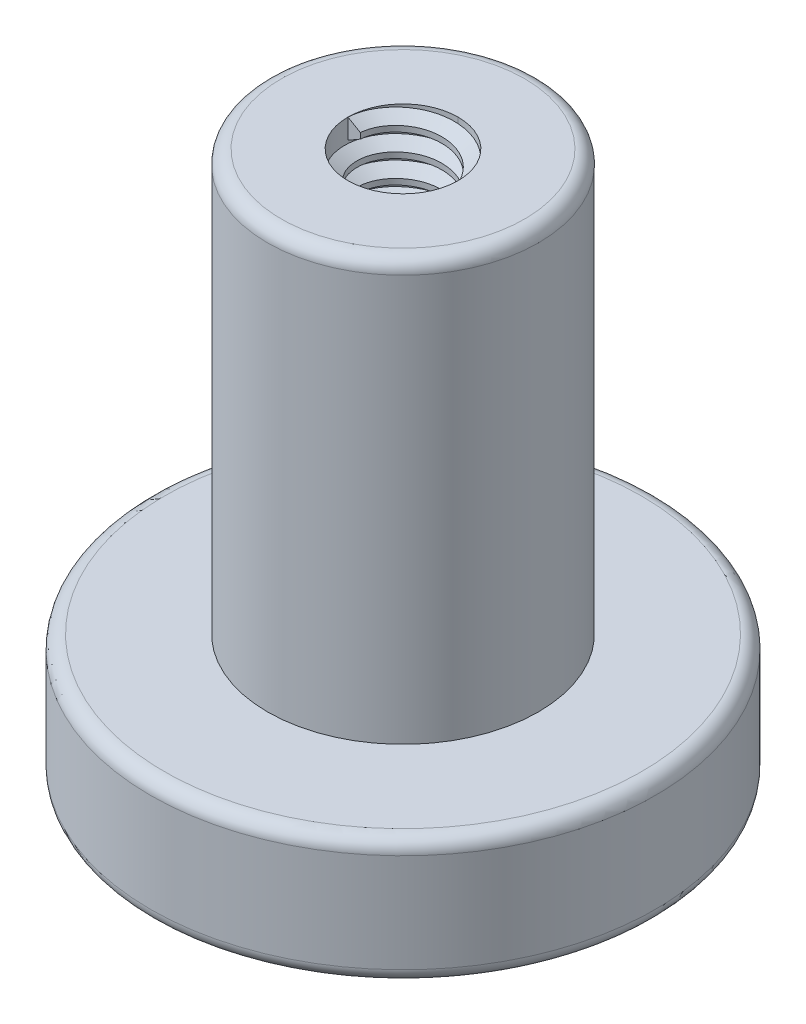
from build123d import *

# Parameters (mm, degrees)
FILLET1_R     = 0.3
CHAMFER1_SIZE = 1
FILLET2_R     = 0.1
THREAD1_PITCH = 0.5


with BuildPart() as part:
    # Sketch1 → Revolve1 (revolve)
    with BuildSketch(Plane(origin=(0, 0, 0), x_dir=(0, 0, -1), z_dir=(1, 0, 0)), mode=Mode.PRIVATE) as revolve1_sk:
        Polygon((-2.95, 11.3), (-2.95, 2.15), (-5.5, 2.15), (-5.5, -0.6), (-4.3, -0.6), (-4.3, 0), (-2.5, 0), (-2.5, 1.2), (-2.1, 1.2), (-2.1, 7.5), (-1.2, 7.5), (-1.2, 11.3), align=None)
    revolve(revolve1_sk.sketch.rotate(Axis((0, 0, 0), (0, 1, 0)), 180), axis=Axis((0, 0, 0), (0, 1, 0)))

    # Fillet1
    fillet1_edges = [part.edges().sort_by_distance(p)[0] for p in [
        (0, 11.3, 2.95),
        (0, 2.15, 5.5),
        (0, -0.6, 5.5),
    ]]
    fillet(fillet1_edges, radius=FILLET1_R)

    # Chamfer1
    # the kernel refuses this chamfer: 1 mm, written as the material it takes off along each edge
    with BuildSketch(Plane(origin=(0, 1.2, 0), x_dir=(0, 0, -1), z_dir=(1, 0, 0))) as chamfer1_piece_1_section:
        Polygon((2.1, CHAMFER1_SIZE), (2.1 + CHAMFER1_SIZE, 0), (2.1, 0), align=None)
    chamfer1_piece_1 = revolve(axis=Axis((0, 1.2, 0), (0, 1, 0)), mode=Mode.PRIVATE)
    chamfer1_piece_1 = chamfer1_piece_1 & Plane(origin=(0, 2.002033499, 0), x_dir=(0, 0, -1), z_dir=(0, 1, 0)) * Cylinder(2.5, 13, mode=Mode.PRIVATE)
    add(chamfer1_piece_1, mode=Mode.SUBTRACT)

    # Fillet2
    fillet2_edges = [part.edges().sort_by_distance(p)[0] for p in [
        (0, -0.6, 4.3),
        (0, 0, 4.3),
        (0, 0, 2.5),
    ]]
    fillet(fillet2_edges, radius=FILLET2_R)

    # Thread1: the profile of Thread Profile2 profile screwed along a right-hand helix of 6 turns, 6 arcs to a turn; built about Z, then put on its axis
    thread1_z = Axis((0, 0, 0), (0, 0, 1))
    thread1_corners = [(1.2003, 0, -0.000173205), (1.2003, 0, 0.437673204), (0.929367062, 0, 0.281249999), (0.929367062, 0, 0.156249999)]
    with BuildLine(mode=Mode.PRIVATE) as thread1_profile:
        Line(thread1_corners[0], thread1_corners[1])
        Line(thread1_corners[1], thread1_corners[2])
        Line(thread1_corners[2], thread1_corners[3])
        Line(thread1_corners[3], thread1_corners[0])
    thread1_cap = Face(thread1_profile.wire())
    thread1_turn_angles = [0, 30, 60, 90, 120, 150, 180, 210, 240, 270, 300, 330, 360]
    thread1_turn_weights = [1, 0.8660254037844387, 1, 0.8660254037844387, 1, 0.8660254037844387, 1, 0.8660254037844387, 1, 0.8660254037844387, 1, 0.8660254037844387, 1]
    thread1_turn_rails = [Edge.make_bspline([Vector(p[0], p[1], 0).rotate(thread1_z, thread1_turn_angles[k]) / thread1_turn_weights[k] + Vector(0, 0, p[2] + THREAD1_PITCH * thread1_turn_angles[k] / 360) for k in range(13)], [0, 0, 0, 1, 1, 2, 2, 3, 3, 4, 4, 5, 5, 6, 6, 6], 2, thread1_turn_weights) for p in thread1_corners]
    thread1_turn_sides = [Face.make_surface_from_curves(thread1_turn_rails[p[0]], thread1_turn_rails[p[1]]) for p in [(0, 1), (1, 2), (2, 3), (3, 0)]]
    thread1 = Plane(origin=(0, 11.3, 0), x_dir=(-1, 0, 0), z_dir=(0, -1, 0)) * Solid(Shell([*[p.moved(Location((0, 0, THREAD1_PITCH * i))) for i in range(6) for p in thread1_turn_sides], thread1_cap, thread1_cap.rotate(thread1_z, 2160).moved(Location((0, 0, THREAD1_PITCH * 2160 / 360)))]))
    add(thread1)


solid = part.part
